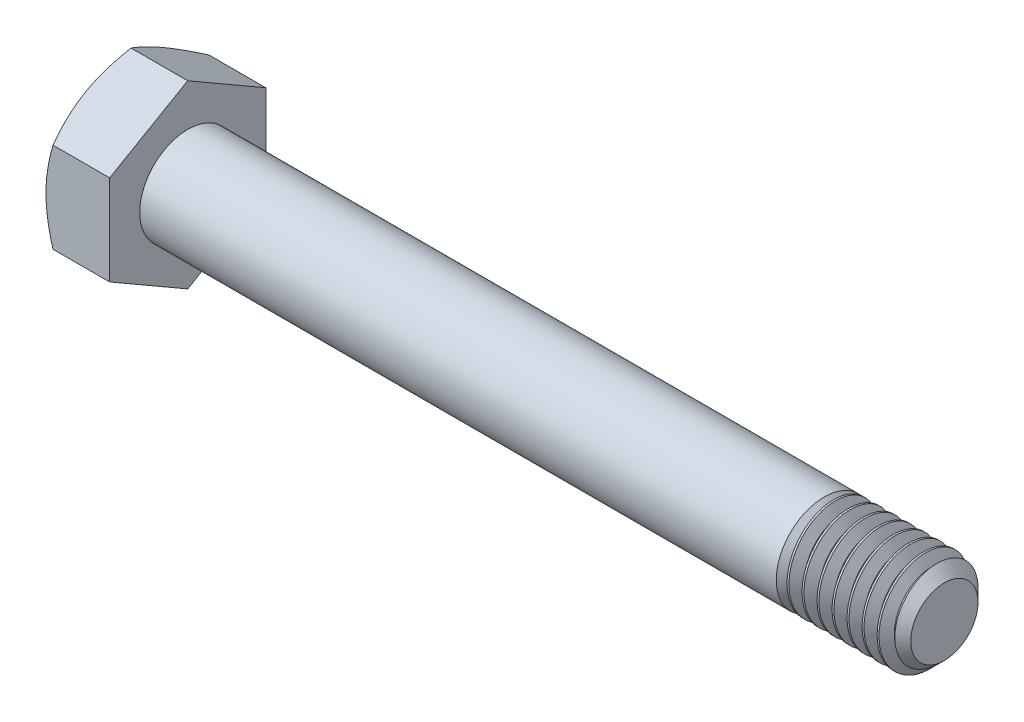
from build123d import *

# Parameters (mm, degrees)
SKETCH2_R           = 4
BOSS_EXTRUDE1_DEPTH = 75
CHAMFER1_SIZE       = 0.9375
CUT_SWEEP1_PITCH    = 1.25
BOSS_EXTRUDE2_DEPTH = 5.3
SKETCH6_OUTSIDE_W   = 315.294
SKETCH6_OUTSIDE_H   = 317.306
SKETCH6_OUTSIDE_R   = 6.5
CUT_EXTRUDE1_DEPTH  = 81.911515572
CUT_EXTRUDE1_DRAFT  = -60
SKETCH7_W           = 0.197562976
SKETCH7_H           = 0.197562976
CUT_EXTRUDE2_DEPTH  = 0.25


with BuildPart() as part:
    # Sketch2 → Boss-Extrude1 (new body)
    with BuildSketch(Plane(origin=(40.15, 0, 0), x_dir=(0, 0, -1), z_dir=(1, 0, 0))):
        Circle(SKETCH2_R)
    extrude(amount=-BOSS_EXTRUDE1_DEPTH)

    # Chamfer1
    chamfer1_edges = [part.edges().sort_by_distance(p)[0] for p in [
        (40.15, 0, 4),
    ]]
    chamfer(chamfer1_edges, length=CHAMFER1_SIZE)

    # Cut-Sweep1: arcs per turn and ends read off the stored shape
    # Cut-Sweep1: the profile of Sketch5 profile screwed along a right-hand helix through 61 turns, 6 arcs to a turn; built about Z, then put on its axis
    cut_sweep1_z = Axis((0, 0, 0), (0, 0, 1))
    cut_sweep1_corners = [(4.0006, 0, 0.00034641), (3.188101184, 0, -0.46875), (3.188101184, 0, -0.625), (4.0006, 0, -1.09409641)]
    with BuildLine(mode=Mode.PRIVATE) as cut_sweep1_profile:
        Line(cut_sweep1_corners[0], cut_sweep1_corners[1])
        Line(cut_sweep1_corners[1], cut_sweep1_corners[2])
        Line(cut_sweep1_corners[2], cut_sweep1_corners[3])
        Line(cut_sweep1_corners[3], cut_sweep1_corners[0])
    cut_sweep1_cap = Face(cut_sweep1_profile.wire())
    cut_sweep1_turn_angles = [0, 30, 60, 90, 120, 150, 180, 210, 240, 270, 300, 330, 360]
    cut_sweep1_turn_weights = [1, 0.8660254037844387, 1, 0.8660254037844387, 1, 0.8660254037844387, 1, 0.8660254037844387, 1, 0.8660254037844387, 1, 0.8660254037844387, 1]
    cut_sweep1_turn_rails = [Edge.make_bspline([Vector(p[0], p[1], 0).rotate(cut_sweep1_z, cut_sweep1_turn_angles[k]) / cut_sweep1_turn_weights[k] + Vector(0, 0, p[2] + CUT_SWEEP1_PITCH * cut_sweep1_turn_angles[k] / 360) for k in range(13)], [0, 0, 0, 1, 1, 2, 2, 3, 3, 4, 4, 5, 5, 6, 6, 6], 2, cut_sweep1_turn_weights) for p in cut_sweep1_corners]
    cut_sweep1_turn_sides = [Face.make_surface_from_curves(cut_sweep1_turn_rails[p[0]], cut_sweep1_turn_rails[p[1]]) for p in [(0, 1), (1, 2), (2, 3), (3, 0)]]
    cut_sweep1 = Plane(origin=(40.15, 0, 0), x_dir=(0, 1, 0), z_dir=(-1, 0, 0)) * Solid(Shell([*[p.moved(Location((0, 0, CUT_SWEEP1_PITCH * i))) for i in range(61) for p in cut_sweep1_turn_sides], cut_sweep1_cap, cut_sweep1_cap.rotate(cut_sweep1_z, 21960).moved(Location((0, 0, CUT_SWEEP1_PITCH * 21960 / 360)))]))
    add(cut_sweep1, mode=Mode.SUBTRACT)

    # Sketch3 → Boss-Extrude2 (add)
    with BuildSketch(Plane.ZY.offset(34.85)):
        Polygon((-6.5, -3.75277675), (0, -7.505553499), (6.5, -3.75277675), (6.5, 3.75277675), (0, 7.505553499), (-6.5, 3.75277675), align=None)
    extrude(amount=BOSS_EXTRUDE2_DEPTH)


with BuildPart() as cut_extrude1_tool:
    # Sketch6 outside → Cut-Extrude1 (with draft: the straight prism first)
    with BuildSketch(Plane.ZY.offset(40.15)):
        Rectangle(SKETCH6_OUTSIDE_W, SKETCH6_OUTSIDE_H)
        Circle(SKETCH6_OUTSIDE_R, mode=Mode.SUBTRACT)
    extrude(amount=-CUT_EXTRUDE1_DEPTH)
    # Cut-Extrude1: the draft: its side faces are tilted about the plane it starts from
    cut_extrude1_sides = [cut_extrude1_tool.faces().sort_by_distance(p)[0] for p in [
        (0.805757786, -158.653, 0),
        (0.805757786, 0, 157.647),
        (0.805757786, 158.653, 0),
        (0.805757786, 0, -157.647),
        (0.805757786, 0, -6.5),
    ]]
    draft(cut_extrude1_sides, Plane.ZY.offset(40.15), CUT_EXTRUDE1_DRAFT)


with BuildPart() as part_1:
    add(part.part)

    # Cut-Extrude1: cut by cut_extrude1_tool
    add(cut_extrude1_tool.part, mode=Mode.SUBTRACT)

    # Sketch7 → Cut-Extrude2 (cut)
    # profile 1 of 4: a face of its own
    with BuildSketch(Plane.ZY.offset(40.15)):
        with BuildLine():
            Line((-1.284159342, 3.25), (-1.481722318, 3.25))
            Line((-1.481722318, 3.25), (-1.481722318, 4.450812462))
            add(Edge.make_bspline(
                [(-1.481722318, 4.450812462), (-1.493098012, 4.439842005), (-1.516741144, 4.417041113), (-1.556707362, 4.384772156), (-1.601314769, 4.352066201), (-1.649984109, 4.320615769), (-1.699594268, 4.291008578), (-1.7475361, 4.264381463), (-1.793009194, 4.241848462), (-1.822962567, 4.229527328), (-1.837335675, 4.22361504)],
                knots=[0, 0, 0, 0, 0.893362401, 1.856755847, 2.901947673, 4.020460078, 5.132200827, 6.168787962, 7.121294059, 8, 8, 8, 8], degree=3))
            Line((-1.837335675, 4.22361504), (-1.837335675, 4.405743408))
            add(Edge.make_bspline(
                [(-1.837335675, 4.405743408), (-1.812648378, 4.418457416), (-1.763991177, 4.443515971), (-1.695249075, 4.486795542), (-1.631070927, 4.533712378), (-1.572519137, 4.584256092), (-1.520031188, 4.635920841), (-1.475798832, 4.688052602), (-1.438788011, 4.73874045), (-1.42021898, 4.774089603), (-1.411340508, 4.790991211)],
                knots=[0, 0, 0, 0, 1.141258006, 2.249351951, 3.335817539, 4.406819942, 5.426913362, 6.360259544, 7.215985427, 8, 8, 8, 8], degree=3))
            Line((-1.411340508, 4.790991211), (-1.284159342, 4.790991211))
            Line((-1.284159342, 4.790991211), (-1.284159342, 3.25))
        make_face()
    # profile 2 of 4: a face of its own
    with BuildSketch(Plane.ZY.offset(40.15)):
        with BuildLine():
            add(Edge.make_bspline(
                [(-0.790251903, 4.010000072), (-0.790052858, 4.032022251), (-0.789663013, 4.075154426), (-0.787244933, 4.138264546), (-0.783023159, 4.198197614), (-0.776721214, 4.25490158), (-0.769258531, 4.308504437), (-0.759556995, 4.358929689), (-0.748641356, 4.406290471), (-0.735544549, 4.450537418), (-0.721155446, 4.492050974), (-0.704830549, 4.530764541), (-0.686462825, 4.566637074), (-0.666954934, 4.60004059), (-0.645279941, 4.630455529), (-0.622746104, 4.658735457), (-0.597715799, 4.683843239), (-0.57122984, 4.706424902), (-0.542898213, 4.726351902), (-0.512870822, 4.743546501), (-0.481263204, 4.758728091), (-0.447472952, 4.770156788), (-0.412201546, 4.779473599), (-0.375177484, 4.786327159), (-0.336359967, 4.790367563), (-0.309833651, 4.79078098), (-0.296344464, 4.790991211)],
                knots=[0, 0, 0, 0, 1.514747001, 2.966751498, 4.343369068, 5.64627492, 6.890416844, 8.064737671, 9.177176366, 10.232018008, 11.237056675, 12.19799043, 13.119080079, 14.007588942, 14.855863561, 15.685992447, 16.491747269, 17.290132607, 18.077525251, 18.870243746, 19.668095604, 20.485086593, 21.319398728, 22.175900658, 23.072407314, 24, 24, 24, 24], degree=3))
            add(Edge.make_bspline(
                [(-0.296344464, 4.790991211), (-0.276554072, 4.790409387), (-0.237675053, 4.789266372), (-0.180911485, 4.779944144), (-0.127415481, 4.763997036), (-0.077221797, 4.742483699), (-0.031188485, 4.715157621), (0.009921203, 4.68193861), (0.045663832, 4.643175459), (0.075649327, 4.598408838), (0.101859643, 4.548873708), (0.125144312, 4.494347738), (0.146192977, 4.43489203), (0.161129567, 4.381670872), (0.171783825, 4.335728479), (0.178836097, 4.297836494), (0.184690897, 4.256950828), (0.189176465, 4.213170395), (0.192856768, 4.166544299), (0.195698897, 4.11704351), (0.197141568, 4.064544309), (0.197419873, 4.028522328), (0.197562976, 4.010000072)],
                knots=[0, 0, 0, 0, 1.134486744, 2.228744715, 3.287356444, 4.328707449, 5.352829806, 6.347195599, 7.349461267, 8.364207941, 9.428085653, 10.559314403, 11.761222316, 13.04268526, 13.726896727, 14.465273606, 15.252205015, 16.094778733, 16.988606776, 17.934225168, 18.937792761, 20, 20, 20, 20], degree=3))
            add(Edge.make_bspline(
                [(0.197562976, 4.010000072), (0.197360203, 3.988081335), (0.196964045, 3.945258767), (0.194610758, 3.882654684), (0.190134593, 3.823173782), (0.184626591, 3.766679807), (0.176294137, 3.713323573), (0.167315467, 3.662878383), (0.156211069, 3.615573301), (0.143254845, 3.571387596), (0.128663193, 3.53008763), (0.11266119, 3.49136128), (0.094937435, 3.455235008), (0.074964401, 3.422061172), (0.053655947, 3.391399446), (0.03085601, 3.363134809), (0.006081205, 3.337674071), (-0.020643434, 3.315160142), (-0.048776137, 3.294879764), (-0.07887653, 3.277515404), (-0.110812868, 3.263129332), (-0.144371773, 3.250829956), (-0.179893749, 3.241817695), (-0.217098671, 3.234918949), (-0.256123623, 3.230856468), (-0.282752541, 3.230450776), (-0.296344464, 3.230243702)],
                knots=[0, 0, 0, 0, 1.508974709, 2.94807912, 4.311757619, 5.615040294, 6.854280449, 8.028314546, 9.141715822, 10.197470207, 11.196696834, 12.155719058, 13.080757287, 13.963948316, 14.818758719, 15.649605906, 16.461113142, 17.260189315, 18.052359509, 18.845763934, 19.647754795, 20.461145776, 21.303032214, 22.167241874, 23.064524267, 24, 24, 24, 24], degree=3))
            add(Edge.make_bspline(
                [(-0.296344464, 3.230243702), (-0.31416505, 3.230752036), (-0.348910289, 3.231743145), (-0.399653148, 3.238477126), (-0.447278028, 3.250329248), (-0.492186617, 3.266224614), (-0.533874131, 3.287485582), (-0.572539611, 3.313353701), (-0.608960011, 3.343227122), (-0.629925808, 3.366796566), (-0.64053621, 3.378724626)],
                knots=[0, 0, 0, 0, 1.10322584, 2.150986741, 3.161425019, 4.136713905, 5.093944212, 6.049774532, 7.013026876, 8, 8, 8, 8], degree=3))
            add(Edge.make_bspline(
                [(-0.64053621, 3.378724626), (-0.652749028, 3.396341795), (-0.677932381, 3.432669151), (-0.707407312, 3.494610663), (-0.733699472, 3.56279957), (-0.754333998, 3.638573732), (-0.770495975, 3.721330072), (-0.782168957, 3.811230974), (-0.788774716, 3.908237599), (-0.789748392, 3.975313505), (-0.790251903, 4.010000072)],
                knots=[0, 0, 0, 0, 0.779365345, 1.607084704, 2.489375761, 3.438383567, 4.461919411, 5.557722155, 6.737039282, 8, 8, 8, 8], degree=3))
        make_face()
        with BuildLine():
            add(Edge.make_bspline(
                [(-0.592688927, 4.010617457), (-0.592492763, 3.980978591), (-0.592117261, 3.924243246), (-0.588194178, 3.843187016), (-0.581440751, 3.770063233), (-0.57251228, 3.704973141), (-0.560723083, 3.647828693), (-0.545920352, 3.59877551), (-0.529234153, 3.557224843), (-0.508585298, 3.52369168), (-0.485977083, 3.496357261), (-0.462635646, 3.472848776), (-0.438011843, 3.452867102), (-0.412266343, 3.436206461), (-0.384999685, 3.423592119), (-0.356510025, 3.414449215), (-0.326791165, 3.409187614), (-0.30655127, 3.408431621), (-0.296344464, 3.408050381)],
                knots=[0, 0, 0, 0, 1.89448813, 3.626469325, 5.185477471, 6.587276848, 7.82441448, 8.910550357, 9.859733512, 10.6775885, 11.416198291, 12.123144072, 12.791880183, 13.439617036, 14.078171869, 14.70637855, 15.347637704, 16, 16, 16, 16], degree=3))
            add(Edge.make_bspline(
                [(-0.296344464, 3.408050381), (-0.286140213, 3.408439952), (-0.265905387, 3.409212463), (-0.236117858, 3.41435804), (-0.207739045, 3.423971614), (-0.180513042, 3.436541403), (-0.154580415, 3.452822298), (-0.130077548, 3.472879447), (-0.106613153, 3.496373973), (-0.084106493, 3.524026105), (-0.063614954, 3.557714303), (-0.046615742, 3.599231123), (-0.032043703, 3.648370213), (-0.020189817, 3.705485547), (-0.011224514, 3.770472726), (-0.00451192, 3.843393697), (-0.000562582, 3.924345633), (-0.000193277, 3.980978457), (0, 4.010617457)],
                knots=[0, 0, 0, 0, 0.652509534, 1.29391342, 1.924290653, 2.562989607, 3.207355802, 3.876242846, 4.583348185, 5.32723334, 6.150888545, 7.094226006, 8.186903555, 9.424320409, 10.81992305, 12.379283064, 14.105084285, 16, 16, 16, 16], degree=3))
            add(Edge.make_bspline(
                [(0, 4.010617457), (-0.000187089, 4.039639765), (-0.000545544, 4.095245408), (-0.00459674, 4.174740087), (-0.010945329, 4.246636517), (-0.01962919, 4.31100098), (-0.03117004, 4.3677636), (-0.045167517, 4.417045216), (-0.061847603, 4.458740728), (-0.081680166, 4.493268967), (-0.103757778, 4.52159149), (-0.126819935, 4.546107098), (-0.151443196, 4.566956825), (-0.178063809, 4.583682782), (-0.205823744, 4.597176663), (-0.235360851, 4.606463495), (-0.266384805, 4.612169035), (-0.287676143, 4.612842166), (-0.298505309, 4.613184533)],
                knots=[0, 0, 0, 0, 1.850066095, 3.544656626, 5.0727657, 6.45041401, 7.682899467, 8.762389858, 9.712573485, 10.538438529, 11.291566246, 11.996865408, 12.681389046, 13.341983376, 13.996294293, 14.643563182, 15.31009126, 16, 16, 16, 16], degree=3))
            add(Edge.make_bspline(
                [(-0.298505309, 4.613184533), (-0.308711474, 4.612916661), (-0.328836725, 4.612388453), (-0.358302727, 4.607346709), (-0.386227312, 4.59891579), (-0.412930404, 4.587495291), (-0.437745374, 4.572125556), (-0.461656324, 4.554180295), (-0.483543356, 4.532315999), (-0.49673229, 4.515970592), (-0.503476896, 4.507611818)],
                knots=[0, 0, 0, 0, 1.021318143, 2.013908504, 2.982026795, 3.937174072, 4.91255697, 5.897578595, 6.924855925, 8, 8, 8, 8], degree=3))
            add(Edge.make_bspline(
                [(-0.503476896, 4.507611818), (-0.510819714, 4.495335366), (-0.5263262, 4.469410087), (-0.543677057, 4.424350882), (-0.559004117, 4.372856788), (-0.57162337, 4.31413553), (-0.580752514, 4.24828784), (-0.58795962, 4.175390186), (-0.591703443, 4.095340795), (-0.592351369, 4.039637751), (-0.592688927, 4.010617457)],
                knots=[0, 0, 0, 0, 0.671104906, 1.417232262, 2.260109084, 3.195198885, 4.23592645, 5.382417421, 6.636286093, 8, 8, 8, 8], degree=3))
        make_face(mode=Mode.SUBTRACT)
    # profile 3 of 4: a face of its own
    with BuildSketch(Plane.ZY.offset(40.15)):
        with Locations((0.592688927, 3.348781488)):
            Rectangle(SKETCH7_W, SKETCH7_H)
    # profile 4 of 4: a face of its own
    with BuildSketch(Plane.ZY.offset(40.15)):
        with BuildLine():
            Line((1.007571176, 3.625369654), (1.205134152, 3.645125952))
            add(Edge.make_bspline(
                [(1.205134152, 3.645125952), (1.206920239, 3.635003602), (1.210372897, 3.615436243), (1.218164458, 3.587549402), (1.226067012, 3.561547623), (1.236268145, 3.538010165), (1.246891881, 3.516297683), (1.258922971, 3.496627755), (1.272575767, 3.479395444), (1.291855309, 3.459202247), (1.319210172, 3.438130304), (1.357127719, 3.421061208), (1.398840582, 3.40958445), (1.428236664, 3.408573426), (1.443444492, 3.408050381)],
                knots=[0, 0, 0, 0, 0.994516507, 1.922484754, 2.80151264, 3.623050913, 4.402748861, 5.140924173, 5.850441436, 6.526872911, 7.841975818, 9.161260782, 10.53140107, 12, 12, 12, 12], degree=3))
            add(Edge.make_bspline(
                [(1.443444492, 3.408050381), (1.456751488, 3.408529578), (1.482941721, 3.409472712), (1.521127946, 3.416783962), (1.557442454, 3.428496432), (1.591253108, 3.445301374), (1.622436856, 3.46575252), (1.649674808, 3.4900526), (1.673330676, 3.517155041), (1.692759492, 3.548382253), (1.709342511, 3.58404897), (1.725011258, 3.6246088), (1.739833634, 3.670760517), (1.753006889, 3.721915473), (1.764802895, 3.776206092), (1.773081217, 3.832402208), (1.778174547, 3.88941128), (1.778719417, 3.927774463), (1.778992858, 3.947026874)],
                knots=[0, 0, 0, 0, 0.897794352, 1.766998465, 2.614902619, 3.466100941, 4.308008728, 5.124841802, 5.922729683, 6.728261092, 7.598214292, 8.574707161, 9.662086263, 10.868425066, 12.139522319, 13.41071447, 14.70057738, 16, 16, 16, 16], degree=3))
            add(Edge.make_bspline(
                [(1.778992858, 3.947026874), (1.778899344, 3.952274865), (1.778675616, 3.964830375), (1.778290769, 3.977382036), (1.778066782, 3.984687316)],
                knots=[0, 0, 0, 0, 0.835966126, 2, 2, 2, 2], degree=3))
            add(Edge.make_bspline(
                [(1.778066782, 3.984687316), (1.768542584, 3.97022413), (1.749509536, 3.941321063), (1.714445959, 3.902529649), (1.674332612, 3.868121138), (1.629778386, 3.838362715), (1.58188343, 3.813940569), (1.531480967, 3.796194448), (1.479005485, 3.785236452), (1.443291513, 3.784030076), (1.425231655, 3.783420035)],
                knots=[0, 0, 0, 0, 0.978840568, 1.956103883, 2.947027447, 3.962820877, 4.980997961, 5.980964245, 6.979013046, 8, 8, 8, 8], degree=3))
            add(Edge.make_bspline(
                [(1.425231655, 3.783420035), (1.410181713, 3.783809962), (1.380555612, 3.784577542), (1.337158587, 3.791399547), (1.295419155, 3.801630137), (1.255732843, 3.817119745), (1.21748219, 3.836276405), (1.181068826, 3.859789736), (1.146436643, 3.887627733), (1.114033143, 3.919443767), (1.084462099, 3.9549069), (1.05838385, 3.993153184), (1.036728508, 4.03436963), (1.018710514, 4.078041798), (1.004807734, 4.124591649), (0.995147123, 4.173910112), (0.988649898, 4.225808926), (0.98809691, 4.261357846), (0.987814879, 4.279488319)],
                knots=[0, 0, 0, 0, 0.975490236, 1.920271282, 2.842894855, 3.757591483, 4.67685385, 5.613562631, 6.563069669, 7.554119451, 8.55387214, 9.553424333, 10.550567425, 11.568071726, 12.613215376, 13.695622473, 14.824733476, 16, 16, 16, 16], degree=3))
            add(Edge.make_bspline(
                [(0.987814879, 4.279488319), (0.988237289, 4.298232953), (0.989063596, 4.334900708), (0.995305351, 4.38851352), (1.005631769, 4.439304987), (1.020691426, 4.487178163), (1.039315186, 4.532440645), (1.062799025, 4.574766099), (1.090238676, 4.614335583), (1.12179809, 4.650767612), (1.1564816, 4.683457226), (1.193305446, 4.712633275), (1.232749472, 4.736615849), (1.274057373, 4.756611333), (1.317541757, 4.772064144), (1.363128302, 4.783233279), (1.410943155, 4.789786979), (1.443527149, 4.790584988), (1.460113868, 4.790991211)],
                knots=[0, 0, 0, 0, 1.151671969, 2.252870106, 3.311924673, 4.331900944, 5.332425074, 6.314476151, 7.300265758, 8.286521684, 9.270545387, 10.225535917, 11.167946231, 12.101233205, 13.04124339, 13.998220545, 14.981004193, 16, 16, 16, 16], degree=3))
            add(Edge.make_bspline(
                [(1.460113868, 4.790991211), (1.472160605, 4.79074757), (1.49610549, 4.790263292), (1.53174045, 4.786565994), (1.56653158, 4.779901008), (1.600705712, 4.771487923), (1.633686425, 4.759809927), (1.666109474, 4.746305519), (1.697583789, 4.729788608), (1.728292766, 4.711006809), (1.758043531, 4.690290273), (1.78541595, 4.666489215), (1.811504082, 4.641230711), (1.835777069, 4.613722031), (1.857467159, 4.583538628), (1.878046883, 4.551747632), (1.896524197, 4.517655353), (1.913374225, 4.481215619), (1.928371403, 4.441678329), (1.940882807, 4.398169752), (1.951607872, 4.350539191), (1.960537546, 4.298723511), (1.967159045, 4.242759655), (1.972032081, 4.182730793), (1.975222249, 4.118591267), (1.975491252, 4.074417814), (1.975629758, 4.051673513)],
                knots=[0, 0, 0, 0, 0.850689348, 1.69088598, 2.526071361, 3.350886897, 4.173587108, 4.994166539, 5.82944675, 6.680632524, 7.535501428, 8.385942454, 9.238956306, 10.098905971, 10.972410977, 11.861345628, 12.77184846, 13.708225841, 14.694799433, 15.754852217, 16.902446579, 18.141290626, 19.466225842, 20.880733292, 22.39393263, 24, 24, 24, 24], degree=3))
            add(Edge.make_bspline(
                [(1.975629758, 4.051673513), (1.975490325, 4.027900399), (1.975218576, 3.981567557), (1.972003363, 3.913933366), (1.967132776, 3.849998865), (1.960506598, 3.789722069), (1.951514674, 3.733194972), (1.940827057, 3.680427456), (1.928222834, 3.631322105), (1.913411036, 3.585874606), (1.896572884, 3.543562676), (1.878123243, 3.503865304), (1.857460667, 3.466841197), (1.834817321, 3.432419349), (1.81048396, 3.400539597), (1.784080657, 3.371287341), (1.755598839, 3.344751007), (1.725401557, 3.320631953), (1.69353413, 3.29937701), (1.660430384, 3.280622167), (1.625716723, 3.265258667), (1.589750014, 3.252655004), (1.552594169, 3.242248635), (1.513946549, 3.235236805), (1.473985704, 3.231265544), (1.446951668, 3.230587277), (1.433257651, 3.230243702)],
                knots=[0, 0, 0, 0, 1.538356107, 2.998194159, 4.380716326, 5.687456969, 6.921258146, 8.08355215, 9.170518603, 10.200253214, 11.174652363, 12.115998813, 13.031191965, 13.915860606, 14.780247615, 15.624154577, 16.462764255, 17.29681422, 18.1223677, 18.939254916, 19.756006416, 20.575278551, 21.404021733, 22.250368457, 23.113728878, 24, 24, 24, 24], degree=3))
            add(Edge.make_bspline(
                [(1.433257651, 3.230243702), (1.418732748, 3.230494839), (1.390314716, 3.230986189), (1.348827314, 3.236152771), (1.309305056, 3.244007659), (1.271862965, 3.255603334), (1.236220636, 3.269877298), (1.202986414, 3.288118612), (1.171569683, 3.309163632), (1.142358031, 3.333436747), (1.115693486, 3.360848821), (1.091567168, 3.390724272), (1.070415495, 3.423450039), (1.052349162, 3.45883318), (1.036346581, 3.496576015), (1.023940229, 3.537184652), (1.013861262, 3.58028456), (1.00970173, 3.610098607), (1.007571176, 3.625369654)],
                knots=[0, 0, 0, 0, 1.08199657, 2.11693069, 3.111083497, 4.081436044, 5.034173265, 5.967546613, 6.901297947, 7.84883568, 8.792454994, 9.747011506, 10.706361727, 11.690764787, 12.70483191, 13.757514363, 14.851376857, 16, 16, 16, 16], degree=3))
        make_face()
        with BuildLine():
            add(Edge.make_bspline(
                [(1.778066782, 4.283810009), (1.777844584, 4.296167498), (1.777412091, 4.320220558), (1.773622923, 4.355313673), (1.767526176, 4.388360963), (1.758968941, 4.419552455), (1.747347963, 4.448557507), (1.733885852, 4.47605331), (1.717423045, 4.501277762), (1.698847657, 4.524570528), (1.678386493, 4.54540537), (1.656104474, 4.563571489), (1.632419371, 4.579143971), (1.606762975, 4.59138813), (1.579978695, 4.601477273), (1.551423134, 4.608071145), (1.521489215, 4.612690284), (1.500880058, 4.613017562), (1.490365698, 4.613184533)],
                knots=[0, 0, 0, 0, 1.20361398, 2.342757417, 3.433960756, 4.474970456, 5.487648377, 6.473933575, 7.452701285, 8.415527761, 9.372491588, 10.291530068, 11.211879743, 12.12647906, 13.055739058, 13.994253148, 14.97671008, 16, 16, 16, 16], degree=3))
            add(Edge.make_bspline(
                [(1.490365698, 4.613184533), (1.479550713, 4.612856809), (1.458245164, 4.612211193), (1.427017644, 4.608053397), (1.397402188, 4.600092498), (1.36919886, 4.589532546), (1.342094419, 4.576470071), (1.317074221, 4.559354236), (1.29309033, 4.539957753), (1.271104705, 4.51745525), (1.251021561, 4.492783687), (1.233326098, 4.466174633), (1.218424276, 4.437615052), (1.206512128, 4.407224018), (1.19677715, 4.375266419), (1.190089912, 4.341456506), (1.18597516, 4.305830273), (1.185579924, 4.281454958), (1.185377855, 4.268992786)],
                knots=[0, 0, 0, 0, 1.007165334, 1.984118292, 2.925321257, 3.856078893, 4.785899085, 5.718627206, 6.671847665, 7.654235469, 8.641842333, 9.630378272, 10.624608936, 11.635186472, 12.665777387, 13.731187195, 14.840042241, 16, 16, 16, 16], degree=3))
            add(Edge.make_bspline(
                [(1.185377855, 4.268992786), (1.185564481, 4.25786364), (1.185930382, 4.23604371), (1.190287864, 4.204199511), (1.196100099, 4.173807131), (1.2053659, 4.145176801), (1.216528497, 4.117892863), (1.231036441, 4.092581934), (1.247371005, 4.068487167), (1.266510109, 4.04641574), (1.287668429, 4.026393087), (1.31077761, 4.008941189), (1.335545758, 3.994002062), (1.36220298, 3.981978182), (1.390589415, 3.972718025), (1.420641701, 3.965900682), (1.452490468, 3.961840104), (1.474301842, 3.961433897), (1.485426624, 3.961226713)],
                knots=[0, 0, 0, 0, 1.102204012, 2.160993585, 3.181057555, 4.164839289, 5.138418409, 6.097303793, 7.050641095, 8.019669129, 8.986440483, 9.932879371, 10.884360123, 11.847412593, 12.824617322, 13.839006415, 14.897795988, 16, 16, 16, 16], degree=3))
            add(Edge.make_bspline(
                [(1.485426624, 3.961226713), (1.495831895, 3.961435921), (1.516311795, 3.961847691), (1.546312698, 3.965925579), (1.574819195, 3.972755565), (1.601959278, 3.982041219), (1.627688956, 3.994060942), (1.651835213, 4.009118787), (1.674864814, 4.026371256), (1.696102673, 4.046529924), (1.715513299, 4.068849511), (1.732299881, 4.093550515), (1.746634721, 4.12018436), (1.7579177, 4.149066744), (1.76695483, 4.179842075), (1.773317571, 4.212705196), (1.777484418, 4.247585953), (1.777869725, 4.271552704), (1.778066782, 4.283810009)],
                knots=[0, 0, 0, 0, 1.017004716, 2.00169281, 2.953445817, 3.879374072, 4.80207141, 5.723561102, 6.657273834, 7.611045633, 8.581233951, 9.544037932, 10.525327521, 11.53237926, 12.57032081, 13.657564536, 14.802009319, 16, 16, 16, 16], degree=3))
        make_face(mode=Mode.SUBTRACT)
    extrude(amount=-CUT_EXTRUDE2_DEPTH, mode=Mode.SUBTRACT)

    # Sketch9 → Revolve1 (revolve)
    with BuildSketch(Plane.XY, mode=Mode.PRIVATE) as revolve1_sk:
        Polygon((-34.85, 4), (-34.85, 0), (22.15, 0), (18.15, 4), align=None)
    revolve(revolve1_sk.sketch.rotate(Axis((-34.85, 0, 0), (1, 0, 0)), 270), axis=Axis((-34.85, 0, 0), (1, 0, 0)))


with BuildPart() as body_2:
    # Split1: the piece on the far side of the plane
    add(part_1.part)
    split(bisect_by=Plane(origin=(28.15, 0, 0), x_dir=(0, 0, 1), z_dir=(1, 0, 0)), keep=Keep.BOTTOM)

    # Sketch10 → Cut-Revolve1 (revolve, cut)
    with BuildSketch(Plane(origin=(0, 0, 0), x_dir=(1, 0, 0), z_dir=(0, 1, 0))):
        Polygon((25.95, 5), (28.15, 5), (28.15, 2.8), (26.95, 4), align=None)
    revolve(axis=Axis((32.127214144, 0, 0), (-1, 0, 0)), mode=Mode.SUBTRACT)


with BuildPart() as part_2:
    add(part_1.part)

    # Split1
    split(bisect_by=Plane(origin=(28.15, 0, 0), x_dir=(0, 0, 1), z_dir=(1, 0, 0)), keep=Keep.TOP)


solid = body_2.part
